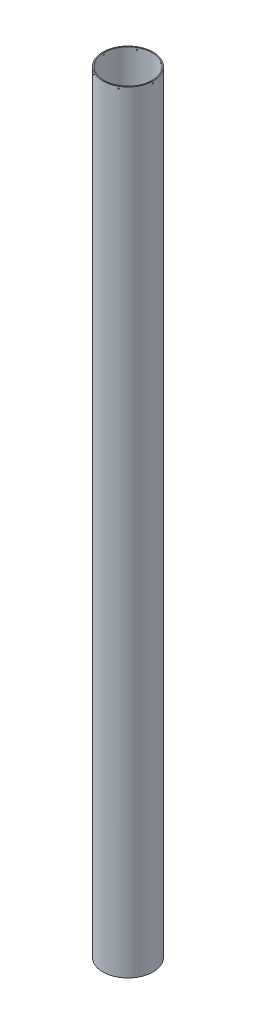
from build123d import *

# Parameters (mm, degrees)
SKETCH1_R           = 79.375
SKETCH1_R_2         = 76.2
BOSS_EXTRUDE1_DEPTH = 1219.2
SKETCH2_R           = 1.5875
CUT_EXTRUDE1_DEPTH  = 1225.35673774
CIRPATTERN1_COUNT   = 6


with BuildPart() as part:
    # Sketch1 → Boss-Extrude1 (new, symmetric)
    with BuildSketch(Plane(origin=(0, 0, 0), x_dir=(1, 0, 0), z_dir=(0, 1, 0))):
        Circle(SKETCH1_R)
        Circle(SKETCH1_R_2, mode=Mode.SUBTRACT)
    extrude(amount=BOSS_EXTRUDE1_DEPTH, both=True)

    # Sketch2 → Cut-Extrude1 (cut, through all)
    with BuildSketch(Plane(origin=(0, 0, 0), x_dir=(0, 0, -1), z_dir=(1, 0, 0))):
        with Locations((0, 1212.85)):
            Circle(SKETCH2_R)
    cut_extrude1 = extrude(amount=-CUT_EXTRUDE1_DEPTH, mode=Mode.SUBTRACT)

    # CirPattern1: Cut-Extrude1 ×6 about axis
    cirpattern1_axis = Axis((0, 1219.2, 0), (0, 1, 0))
    for i in range(1, CIRPATTERN1_COUNT):
        add(cut_extrude1.rotate(cirpattern1_axis, i * 360 / CIRPATTERN1_COUNT), mode=Mode.SUBTRACT)


solid = part.part
